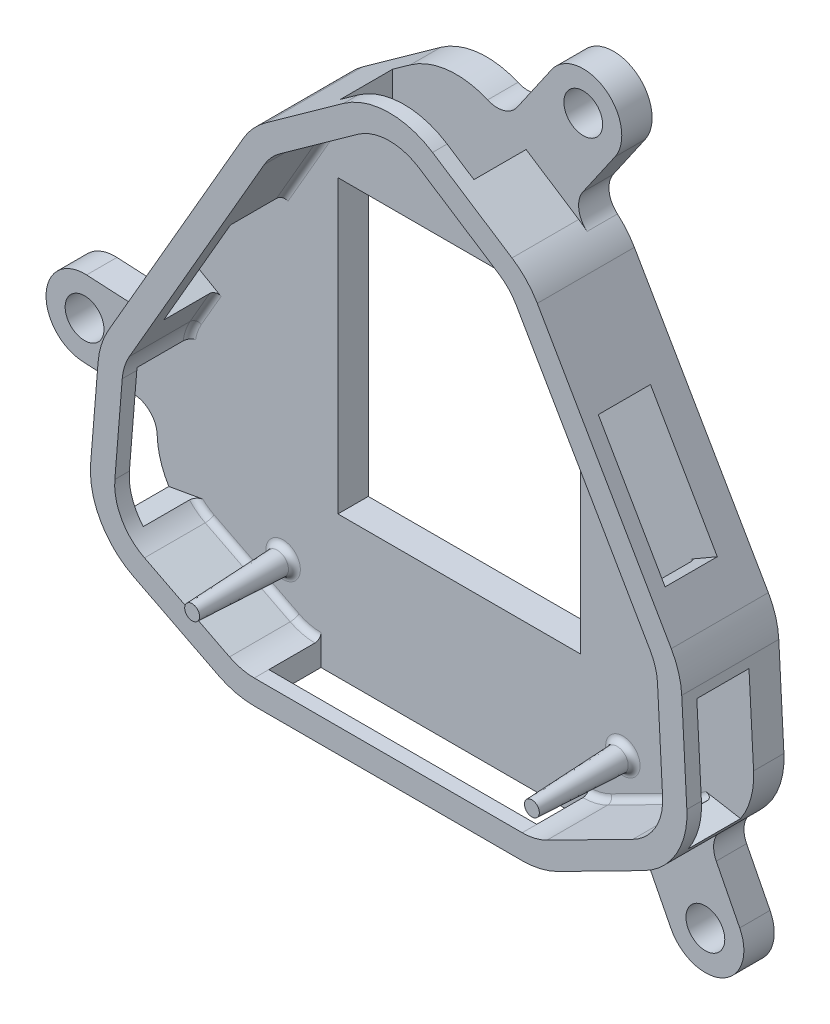
from build123d import *

# Parameters (mm, degrees)
SKETCH4_W                     = 20
SKETCH4_H                     = 24
BOSS_EXTRUDE1_DEPTH           = 2.5
BOSS_EXTRUDE3_DEPTH           = 8
SKETCH4_5_R                   = 1.04999954
BOSS_EXTRUDE4_DEPTH           = 10
BOSS_EXTRUDE4_DRAFT           = 2.5
BOSS_EXTRUDE4_PROFILE_2_DEPTH = 10
BOSS_EXTRUDE4_PROFILE_2_DRAFT = 2.5
SKETCH5_W                     = 22.082114238
SKETCH5_H                     = 4.3
CUT_EXTRUDE1_DEPTH            = 2
SKETCH6_W                     = 4.3
SKETCH6_H                     = 11.01458554
CUT_EXTRUDE2_DEPTH            = 2
SKETCH7_W                     = 4.3
SKETCH7_H                     = 11.01461094
CUT_EXTRUDE3_DEPTH            = 2
SKETCH8_W                     = 11.0146084
SKETCH8_H                     = 4.3
CUT_EXTRUDE5_DEPTH            = 7
CUT_EXTRUDE6_DEPTH            = 7
CUT_EXTRUDE6_DEPTH_BACK       = 7
SKETCH9_W                     = 4.3
SKETCH9_H                     = 11.01461094
SKETCH10_W                    = 4.3
SKETCH10_H                    = 11.01460078
CUT_EXTRUDE7_DEPTH            = 50.390708853
FILLET1_R                     = 0.5
SKETCH11_R                    = 1.6
BOSS_EXTRUDE5_DEPTH           = 2.5
FILLET2_R                     = 2
FILLET3_R                     = 0.5


with BuildPart() as part:
    # Sketch4 → Boss-Extrude1 (new body)
    with BuildSketch(Plane.XY):
        with BuildLine():
            Line((14.40579252, 37.778127459), (3.287922462, 18.521396993))
            ThreePointArc((3.287922462, 18.521396993), (2.712012987, 17.207148367), (2.438487448, 15.798565764))
            Line((2.438487448, 15.798565764), (1.829191453, 8.310127992))
            ThreePointArc((1.829191453, 8.310127992), (2.63339515, 4.61256251), (5.360675193, 1.989457929))
            Line((5.360675193, 1.989457929), (12.365250755, -1.573764605))
            ThreePointArc((12.365250755, -1.573764605), (13.797062184, -2.101161427), (15.312371851, -2.28023681))
            Line((15.312371851, -2.28023681), (37.394486089, -2.28023681))
            ThreePointArc((37.394486089, -2.28023681), (38.909799875, -2.101158221), (40.3416142, -1.57375633))
            Line((40.3416142, -1.57375633), (47.418316215, 2.026189747))
            ThreePointArc((47.418316215, 2.026189747), (50.100366868, 4.569660453), (50.962085043, 8.164111834))
            Line((50.962085043, 8.164111834), (50.541308423, 16.092675178))
            ThreePointArc((50.541308423, 16.092675178), (50.282176527, 17.596348563), (49.679645161, 18.998182698))
            Line((49.679645161, 18.998182698), (38.638559268, 38.121912018))
            ThreePointArc((38.638559268, 38.121912018), (37.725784419, 39.344680467), (36.553097986, 40.32096277))
            Line((36.553097986, 40.32096277), (30.005596257, 44.579063932))
            ThreePointArc((30.005596257, 44.579063932), (26.31632103, 45.628405202), (22.677723188, 44.41494958))
            Line((22.677723188, 44.41494958), (16.250788585, 39.813062423))
            ThreePointArc((16.250788585, 39.813062423), (15.219571198, 38.894166534), (14.40579252, 37.778127459))
        make_face()
        with Locations((26.709430744, 21.378369589)):
            Rectangle(SKETCH4_W, SKETCH4_H, mode=Mode.SUBTRACT)
    extrude(amount=BOSS_EXTRUDE1_DEPTH)

    # Sketch4<4> → Boss-Extrude3 (add)
    with BuildSketch(Plane.XY):
        with BuildLine():
            Line((22.677723188, 44.41494958), (16.250788585, 39.813062423))
            ThreePointArc((16.250788585, 39.813062423), (15.219571198, 38.894166534), (14.40579252, 37.778127459))
            Line((14.40579252, 37.778127459), (3.287922462, 18.521396993))
            ThreePointArc((3.287922462, 18.521396993), (2.712012987, 17.207148367), (2.438487448, 15.798565764))
            Line((2.438487448, 15.798565764), (1.829191453, 8.310127992))
            ThreePointArc((1.829191453, 8.310127992), (2.63339515, 4.61256251), (5.360675193, 1.989457929))
            Line((5.360675193, 1.989457929), (12.365250755, -1.573764605))
            ThreePointArc((12.365250755, -1.573764605), (13.797062184, -2.101161427), (15.312371851, -2.28023681))
            Line((15.312371851, -2.28023681), (37.394486089, -2.28023681))
            ThreePointArc((37.394486089, -2.28023681), (38.909799875, -2.101158221), (40.3416142, -1.57375633))
            Line((40.3416142, -1.57375633), (47.418316215, 2.026189747))
            ThreePointArc((47.418316215, 2.026189747), (50.100366868, 4.569660453), (50.962085043, 8.164111834))
            Line((50.962085043, 8.164111834), (50.541308423, 16.092675178))
            ThreePointArc((50.541308423, 16.092675178), (50.282176527, 17.596348563), (49.679645161, 18.998182698))
            Line((49.679645161, 18.998182698), (38.638559268, 38.121912018))
            ThreePointArc((38.638559268, 38.121912018), (37.725784419, 39.344680467), (36.553097986, 40.32096277))
            Line((36.553097986, 40.32096277), (30.005596257, 44.579063932))
            ThreePointArc((30.005596257, 44.579063932), (26.31632103, 45.628405202), (22.677723188, 44.41494958))
        make_face()
        with BuildLine():
            ThreePointArc((28.915219047, 42.902437098), (26.361103849, 43.62890664), (23.842072273, 42.788821908))
            Line((23.842072273, 42.788821908), (17.415154311, 38.186946666))
            ThreePointArc((17.415154311, 38.186946666), (16.701235421, 37.550786049), (16.137851593, 36.778141775))
            Line((16.137851593, 36.778141775), (5.01997076, 17.521392647))
            ThreePointArc((5.01997076, 17.521392647), (4.621263952, 16.611530408), (4.43189892, 15.636360013))
            Line((4.43189892, 15.636360013), (3.822603234, 8.147926041))
            ThreePointArc((3.822603234, 8.147926041), (4.379359007, 5.588067615), (6.267480562, 3.772069503))
            Line((6.267480562, 3.772069503), (13.272044416, 0.208852925))
            ThreePointArc((13.272044416, 0.208852925), (14.263297755, -0.156264413), (15.312356713, -0.280236811))
            Line((15.312356713, -0.280236811), (37.394499544, -0.280236811))
            ThreePointArc((37.394499544, -0.280236811), (38.443560406, -0.156262143), (39.434814891, 0.208858326))
            Line((39.434814891, 0.208858326), (46.511508891, 3.808800326))
            ThreePointArc((46.511508891, 3.808800326), (48.368316966, 5.56966202), (48.964895143, 8.058128338))
            Line((48.964895143, 8.058128338), (48.544118496, 15.986692189))
            ThreePointArc((48.544118496, 15.986692189), (48.364721527, 17.027695486), (47.947587053, 17.998195342))
            Line((47.947587053, 17.998195342), (36.906508289, 37.121912315))
            ThreePointArc((36.906508289, 37.121912315), (36.274587318, 37.968443941), (35.462727713, 38.644331426))
            Line((35.462727713, 38.644331426), (28.915219047, 42.902437098))
        make_face(mode=Mode.SUBTRACT)
    extrude(amount=BOSS_EXTRUDE3_DEPTH)


with BuildPart() as body_2:
    # Sketch4<5> → Boss-Extrude4 (with draft: the straight prism first)
    with BuildSketch(Plane.XY):
        with Locations((12.191451144, 3.853385589)):
            Circle(SKETCH4_5_R)
    extrude(amount=BOSS_EXTRUDE4_DEPTH)
    # Boss-Extrude4: the draft: its side faces are tilted about the plane it starts from
    boss_extrude4_sides = [body_2.faces().sort_by_distance(p)[0] for p in [
        (11.141451604, 3.853385589, 5),
    ]]
    draft(boss_extrude4_sides, Plane.XY, BOSS_EXTRUDE4_DRAFT)


with BuildPart() as body_3:
    # Sketch4<5> → Boss-Extrude4 profile 2 (with draft: the straight prism first)
    with BuildSketch(Plane.XY):
        with Locations((40.191445944, 3.853385589)):
            Circle(SKETCH4_5_R)
    extrude(amount=BOSS_EXTRUDE4_PROFILE_2_DEPTH)
    # Boss-Extrude4 profile 2: the draft: its side faces are tilted about the plane it starts from
    boss_extrude4_profile_2_sides = [body_3.faces().sort_by_distance(p)[0] for p in [
        (39.141446404, 3.853385589, 5),
    ]]
    draft(boss_extrude4_profile_2_sides, Plane.XY, BOSS_EXTRUDE4_PROFILE_2_DRAFT)

    # Combine1: union body 2, part
    add(body_2.part)
    add(part.part)

    # Sketch5 → Cut-Extrude1 (cut)
    with BuildSketch(Plane.XZ.offset(2.28023681)):
        with Locations((26.35342897, 4.65)):
            Rectangle(SKETCH5_W, SKETCH5_H)
    extrude(amount=-CUT_EXTRUDE1_DEPTH, mode=Mode.SUBTRACT)

    # Sketch6 → Cut-Extrude2 (cut)
    with BuildSketch(Plane(origin=(-5.554054319, 3.206632316, 0), x_dir=(0, 0, 1), z_dir=(-0.8660255685351766, 0.4999997146432426, 0))):
        with Locations((4.65, 26.440930265)):
            Rectangle(SKETCH6_W, SKETCH6_H)
    extrude(amount=-CUT_EXTRUDE2_DEPTH, mode=Mode.SUBTRACT)

    # Sketch7 → Cut-Extrude3 (cut)
    with BuildSketch(Plane(origin=(45.486194048, 26.261455964, 0), x_dir=(0, 0, -1), z_dir=(0.8660254896413927, 0.49999985129136404, 0))):
        with Locations((-4.65, 0.535419369)):
            Rectangle(SKETCH7_W, SKETCH7_H)
    extrude(amount=-CUT_EXTRUDE3_DEPTH, mode=Mode.SUBTRACT)

    # Sketch8 → Cut-Extrude5 (cut)
    with BuildSketch(Plane(origin=(0, 39.051384789, 0), x_dir=(1, 0, 0), z_dir=(0, 1, 0))):
        with Locations((26.709405344, -4.65)):
            Rectangle(SKETCH8_W, SKETCH8_H)
    extrude(amount=CUT_EXTRUDE5_DEPTH, mode=Mode.SUBTRACT)

    # Sketch9 → Cut-Extrude6 (cut, two sides: drawn at the far end of the back side and taken through both)
    with BuildSketch(Plane(origin=(6.217218431, 4.980434971, 0), x_dir=(0, 0, -1), z_dir=(0.9848073574644705, 0.1736504209146836, 0)).offset(-CUT_EXTRUDE6_DEPTH_BACK)):
        with Locations((-4.65, 5.50730547)):
            Rectangle(SKETCH9_W, SKETCH9_H)
    extrude(amount=CUT_EXTRUDE6_DEPTH + CUT_EXTRUDE6_DEPTH_BACK, mode=Mode.SUBTRACT)

    # Sketch10 → Cut-Extrude7 (cut, through all)
    with BuildSketch(Plane(origin=(40.798758754, 17.009315643, 0), x_dir=(0, 0, -1), z_dir=(0.984808431082818, -0.17364433209350222, 0))):
        with Locations((-4.65, -5.50730039)):
            Rectangle(SKETCH10_W, SKETCH10_H)
    extrude(amount=CUT_EXTRUDE7_DEPTH, mode=Mode.SUBTRACT)

    # Fillet1
    fillet1_edges = [body_3.edges().sort_by_distance(p)[0] for p in [
        (47.093836217, 19.476935754, 2.5),
        (36.274587318, 37.968443941, 2.5),
        (33.839718629, 39.699838877, 2.5),
        (38.819644919, 33.808261157, 2.5),
        (48.364721527, 17.027695486, 2.5),
        (48.553307785, 15.813541277, 2.5),
        (42.973161891, 2.008829326, 2.5),
        (38.443560406, -0.156262143, 2.5),
        (37.394492817, -0.280236811, 2.5),
        (14.263297755, -0.156264413, 2.5),
        (9.769762489, 1.990461214, 2.5),
        (5.575293328, 4.207547209, 2.5),
        (4.655161471, 16.715709164, 2.5),
        (5.832390176, 18.928545423, 2.5),
        (16.701235421, 37.550786049, 2.5),
        (19.308627728, 39.542733139, 2.5),
        (47.104551996, 4.17063929, 2.5),
        (15.312364282, -0.280236811, 2.5),
        (14.144975406, 33.32637634, 2.5),
    ]]
    fillet(fillet1_edges, radius=FILLET1_R)

    # Sketch11 → Boss-Extrude5 (add)
    # profile 1 of 3: a face of its own
    with BuildSketch(Plane(origin=(0, 0, 0), x_dir=(-1, 0, 0), z_dir=(0, 0, -1))):
        with BuildLine():
            Line((4.004551173, 16.080144072), (-2.43359986, 15.738495777))
            Line((-2.43359986, 15.738495777), (-1.918430141, 9.406899296))
            Line((-1.918430141, 9.406899296), (4.341048167, 9.739066105))
            ThreePointArc((4.341048167, 9.739066105), (7.343338654, 13.077853585), (4.004551173, 16.080144072))
        make_face()
        with Locations((4.17279967, 12.909605088)):
            Circle(SKETCH11_R, mode=Mode.SUBTRACT)
    # profile 2 of 3: a face of its own
    with BuildSketch(Plane(origin=(0, 0, 0), x_dir=(-1, 0, 0), z_dir=(0, 0, -1))):
        with BuildLine():
            Line((-44.159353036, -6.491637762), (-41.387088639, -1.041919381))
            Line((-41.387088639, -1.041919381), (-47.046859688, 1.837228354))
            Line((-47.046859688, 1.837228354), (-49.819136139, -3.612513724))
            ThreePointArc((-49.819136139, -3.612513724), (-48.428806607, -7.881967295), (-44.159353036, -6.491637762))
        make_face()
        with Locations((-46.989244588, -5.052075743)):
            Circle(SKETCH11_R, mode=Mode.SUBTRACT)
    # profile 3 of 3: a face of its own
    with BuildSketch(Plane(origin=(0, 0, 0), x_dir=(-1, 0, 0), z_dir=(0, 0, -1))):
        with BuildLine():
            Line((-39.536891671, 46.279338916), (-35.7703782, 40.829996624))
            Line((-35.7703782, 40.829996624), (-30.444974788, 44.293318572))
            Line((-30.444974788, 44.293318572), (-34.313232544, 49.889863162))
            ThreePointArc((-34.313232544, 49.889863162), (-38.730324231, 50.696430602), (-39.536891671, 46.279338916))
        make_face()
        with Locations((-36.925062108, 48.084601039)):
            Circle(SKETCH11_R, mode=Mode.SUBTRACT)
    extrude(amount=-BOSS_EXTRUDE5_DEPTH)

    # Fillet2
    # the kernel refuses this fillet: 2 mm, written as the material it adds along each edge
    with BuildSketch(Plane(origin=(1.918430141, 9.406899296, 0), x_dir=(-0.05866855654021314, -0.9982775167624921, 0), z_dir=(0, 0, 1))) as fillet2_piece_1:
        with BuildLine():
            CenterArc((2.011357854, -1.991882194), FILLET2_R, 95.164032514, 85.161738675)
            Line((0.011390182, -2.003253693), (-0.188606585, -2.004390842))
            Line((-0.188606585, -2.004390842), (-0.199996767, -0.00113715))
            Line((-0.199996767, -0.00113715), (0.00449638, 0.19994945))
            ThreePointArc((0.00449638, 0.19994945), (1.104615402, 0.175210432), (1.813341585, 0.199188219))
            Line((1.813341585, 0.199188219), (1.831343064, 0))
        make_face()
    extrude(amount=2.5)
    with BuildSketch(Plane(origin=(2.43359986, 15.738495777, 0), x_dir=(0.1877449161137976, 0.9822178202788947, 0), z_dir=(0, 0, 1))) as fillet2_piece_2:
        with BuildLine():
            CenterArc((1.747071195, 1.986425497), FILLET2_R, 187.783588402, 75.537117688)
            Line((-0.234502152, 1.715561935), (-0.432659487, 1.688475579))
            Line((-0.432659487, 1.688475579), (-0.198157335, -0.027086356))
            Line((-0.198157335, -0.027086356), (0.021494341, -0.198841629))
            ThreePointArc((0.021494341, -0.198841629), (0.081411755, -0.192364689), (1.491185217, -0.19864255))
            Line((1.491185217, -0.19864255), (1.514447579, 0))
        make_face()
    extrude(amount=2.5)
    with BuildSketch(Plane(origin=(47.046859688, 1.837228354, 0), x_dir=(0.8575232290308502, 0.5144452465253264, 0), z_dir=(0, 0, 1))) as fillet2_piece_3:
        with BuildLine():
            CenterArc((1.866060415, -1.986192029), FILLET2_R, 96.736553334, 79.265444126)
            Line((-0.129072548, -1.846748636), (-0.328585844, -1.832804297))
            Line((-0.328585844, -1.832804297), (-0.199513296, 0.013944339))
            Line((-0.199513296, 0.013944339), (0.013943504, 0.199513355))
            ThreePointArc((0.013943504, 0.199513355), (0.429688452, 0.17045795), (1.607990884, 0.198619203))
            Line((1.607990884, 0.198619203), (1.63145175, 0))
        make_face()
    extrude(amount=2.5)
    with BuildSketch(Plane(origin=(41.387088639, -1.041919381, 0), x_dir=(-0.8989189088243236, -0.4381150480845044, 0), z_dir=(0, 0, 1))) as fillet2_piece_4:
        with BuildLine():
            CenterArc((1.966235607, 1.993542475), FILLET2_R, 180.97870365, 84.415840865)
            Line((-0.033472619, 1.959380935), (-0.233443442, 1.95596478))
            Line((-0.233443442, 1.95596478), (-0.199970823, -0.003416154))
            Line((-0.199970823, -0.003416154), (0.003416991, -0.199970808))
            ThreePointArc((0.003416991, -0.199970808), (1.176215921, -0.179930664), (1.789589173, -0.199354248))
            Line((1.789589173, -0.199354248), (1.80564794, 0))
        make_face()
    extrude(amount=2.5)
    with BuildSketch(Plane(origin=(30.444974788, 44.293318572, 0), x_dir=(-0.8679468320026006, 0.49665712198321443, 0), z_dir=(0, 0, 1))) as fillet2_piece_5:
        with BuildLine():
            CenterArc((1.837813114, -1.987599747), FILLET2_R, 96.383554137, 78.743811694)
            Line((-0.154958845, -1.817717677), (-0.354236041, -1.80072947))
            Line((-0.354236041, -1.80072947), (-0.199277196, 0.016988207))
            Line((-0.199277196, 0.016988207), (0.011368079, 0.199676656))
            ThreePointArc((0.011368079, 0.199676656), (0.534643198, 0.169885328), (1.593209014, 0.198759975))
            Line((1.593209014, 0.198759975), (1.61544575, 0))
        make_face()
    extrude(amount=2.5)
    with BuildSketch(Plane(origin=(35.7703782, 40.829996624, 0), x_dir=(0.8206094371402165, -0.5714894151919326, 0), z_dir=(0, 0, 1))) as fillet2_piece_6:
        with BuildLine():
            CenterArc((1.992981829, 1.989887472), FILLET2_R, 180.202436157, 84.033408627)
            Line((-0.007005688, 1.982821132), (-0.20700444, 1.982114498))
            Line((-0.20700444, 1.982114498), (-0.199998752, -0.000706634))
            Line((-0.199998752, -0.000706634), (0.006340066, -0.199899484))
            ThreePointArc((0.006340066, -0.199899484), (0.939555596, -0.170301368), (1.772027313, -0.198988747))
            Line((1.772027313, -0.198988747), (1.792114087, 0))
        make_face()
    extrude(amount=2.5)
    # the kernel refuses this fillet: 2 mm, written as the material it takes off along each edge

    # Fillet3
    fillet3_edges = [body_3.edges().sort_by_distance(p)[0] for p in [
        (39.250598762, 3.853385589, 2.5),
        (11.250603962, 3.853385589, 2.5),
    ]]
    fillet(fillet3_edges, radius=FILLET3_R)


solid = body_3.part
